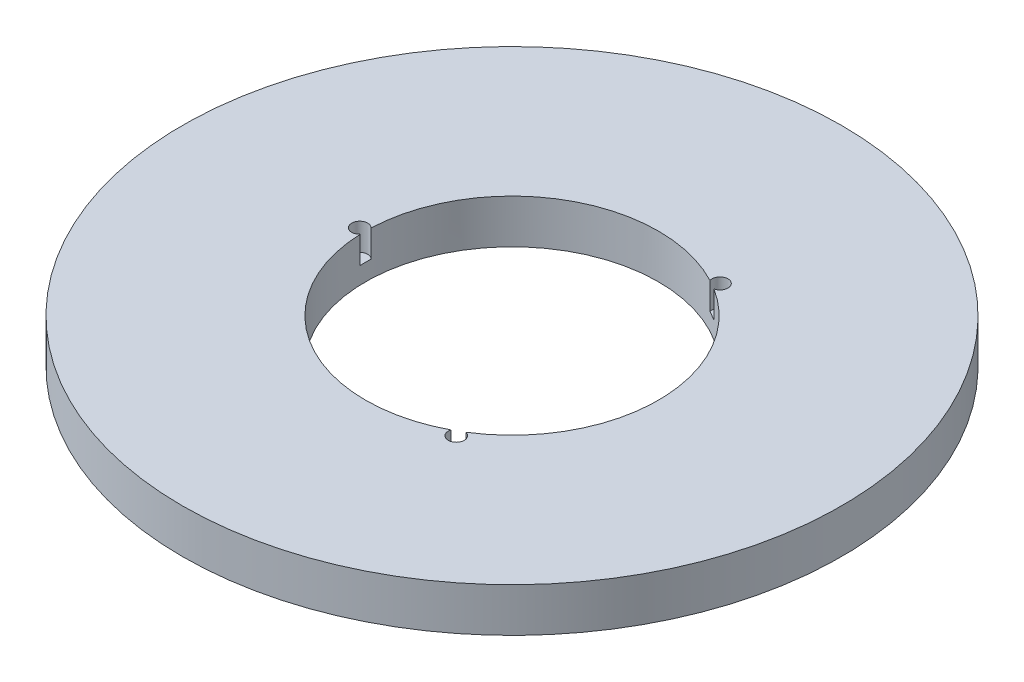
from build123d import *

# Parameters (mm, degrees)
SKETCH1_R           = 90
BOSS_EXTRUDE1_DEPTH = 12
SKETCH2_R           = 40
CUT_EXTRUDE1_DEPTH  = 128.843654516
SKETCH3_R           = 2.184078632
CUT_EXTRUDE2_DEPTH  = 7.378568464
CIRPATTERN1_COUNT   = 3


with BuildPart() as part:
    # Sketch1 → Boss-Extrude1 (new body)
    with BuildSketch(Plane(origin=(0, 0, 0), x_dir=(1, 0, 0), z_dir=(0, 1, 0))):
        Circle(SKETCH1_R)
    extrude(amount=BOSS_EXTRUDE1_DEPTH)

    # Sketch2 → Cut-Extrude1 (cut, through all)
    with BuildSketch(Plane(origin=(0, 0, 0), x_dir=(1, 0, 0), z_dir=(0, 1, 0))):
        Circle(SKETCH2_R)
    extrude(amount=CUT_EXTRUDE1_DEPTH, mode=Mode.SUBTRACT)

    # Sketch3 → Cut-Extrude2 (cut)
    with BuildSketch(Plane(origin=(0, 12, 0), x_dir=(1, 0, 0), z_dir=(0, 1, 0))):
        with Locations((-41.586697904, 0)):
            Circle(SKETCH3_R)
    cut_extrude2 = extrude(amount=-CUT_EXTRUDE2_DEPTH, mode=Mode.SUBTRACT)

    # CirPattern1: Cut-Extrude2 ×3 about axis
    cirpattern1_axis = Axis((0, 0, 0), (0, 1, 0))
    for i in range(1, CIRPATTERN1_COUNT):
        add(cut_extrude2.rotate(cirpattern1_axis, i * 360 / CIRPATTERN1_COUNT), mode=Mode.SUBTRACT)


solid = part.part
